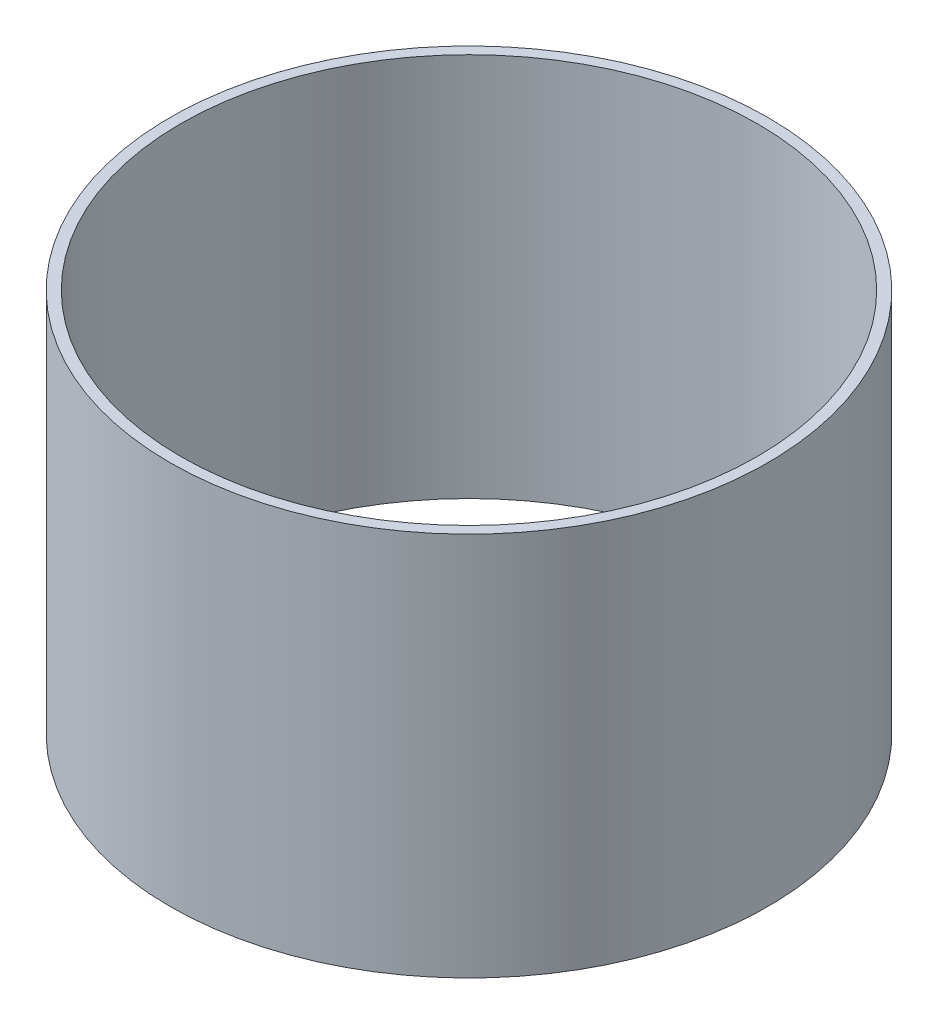
from build123d import *

# Parameters (mm, degrees)
SKETCH1_R           = 70
SKETCH1_R_2         = 67.5
BOSS_EXTRUDE1_DEPTH = 90


with BuildPart() as part:
    # Sketch1 → Boss-Extrude1 (new body)
    with BuildSketch(Plane(origin=(0, 0, 0), x_dir=(1, 0, 0), z_dir=(0, 1, 0))):
        Circle(SKETCH1_R)
        Circle(SKETCH1_R_2, mode=Mode.SUBTRACT)
    extrude(amount=BOSS_EXTRUDE1_DEPTH)


solid = part.part
